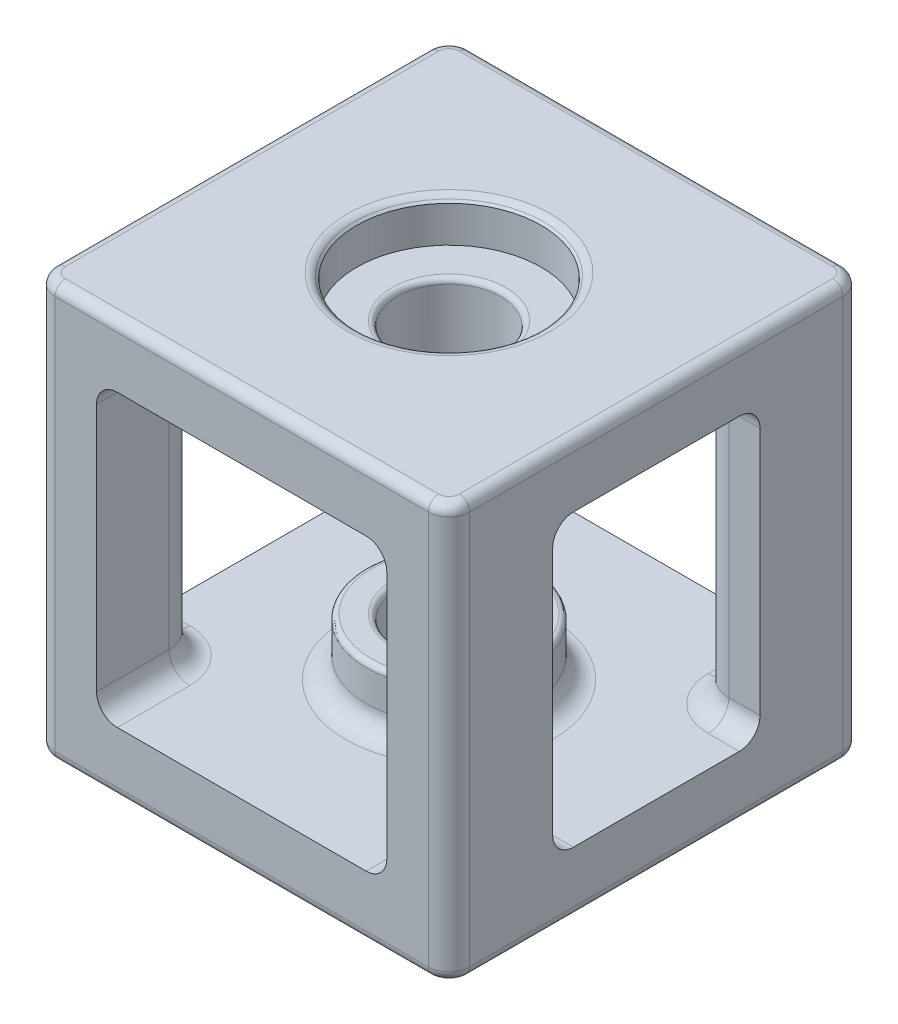
from build123d import *

# Parameters (mm, degrees)
SKETCH1_W             = 20
SKETCH1_H             = 20
BOSS_EXTRUDE1_DEPTH   = 3
SKETCH1_3_R           = 4
BOSS_EXTRUDE2_DEPTH   = 5.75
SKETCH2_R             = 2.5
CUT_EXTRUDE1_DEPTH    = 5.75
SKETCH1_4_W           = 3
SKETCH1_4_H           = 5
BOSS_EXTRUDE3_DEPTH   = 20
MIRROR2_START         = 17
MIRROR2_OUTLINE_R     = 2.5
MIRROR2_DEPTH         = 3
MIRROR2_START_2       = 14.25
MIRROR2_2_OUTLINE_R   = 4
MIRROR2_2_OUTLINE_R_2 = 2.5
MIRROR2_2_DEPTH       = 2.75
FILLET1_R             = 1
FILLET2_R             = 1.5
FILLET5_R             = 1
SKETCH5_R             = 4.45
CUT_EXTRUDE2_DEPTH    = 2
CHAMFER1_SIZE         = 0.25
FILLET6_R             = 0.5
FILLET7_R             = 0.25


# Read off the part's stored shape, not the designer's step: Mirror2
with BuildPart() as part:
    # Sketch1 → Boss-Extrude1 (new body)
    with BuildSketch(Plane(origin=(0, 0, 0), x_dir=(1, 0, 0), z_dir=(0, 1, 0))):
        Rectangle(SKETCH1_W, SKETCH1_H)
    extrude(amount=BOSS_EXTRUDE1_DEPTH)

    # Sketch1<3> → Boss-Extrude2 (add)
    with BuildSketch(Plane(origin=(0, 0, 0), x_dir=(1, 0, 0), z_dir=(0, 1, 0))):
        with Locations(Location((0, 0, 0), (0, 0, 90))):
            Circle(SKETCH1_3_R)
    extrude(amount=BOSS_EXTRUDE2_DEPTH)

    # Sketch2 → Cut-Extrude1 (cut)
    with BuildSketch(Plane(origin=(0, 5.75, 0), x_dir=(1, 0, 0), z_dir=(0, 1, 0))):
        with Locations(Location((0, 0, 0), (0, 0, 270))):
            Circle(SKETCH2_R)
    extrude(amount=-CUT_EXTRUDE1_DEPTH, mode=Mode.SUBTRACT)

    # Sketch1<4> → Boss-Extrude3 (add)
    with BuildSketch(Plane(origin=(0, 0, 0), x_dir=(1, 0, 0), z_dir=(0, 1, 0))):
        with Locations((8.5, 7.5)):
            Rectangle(SKETCH1_4_W, SKETCH1_4_H)
        with Locations((-8.5, 7.5)):
            Rectangle(SKETCH1_4_W, SKETCH1_4_H)
        with Locations((8.5, -7.5)):
            Rectangle(SKETCH1_4_W, SKETCH1_4_H)
        with Locations((-8.5, -7.5)):
            Rectangle(SKETCH1_4_W, SKETCH1_4_H)
    extrude(amount=BOSS_EXTRUDE3_DEPTH)

    # Mirror2 outline → Mirror2 (add)
    with BuildSketch(Plane(origin=(0, 0, 0), x_dir=(1, 0, 0), z_dir=(0, 1, 0)).offset(MIRROR2_START)):
        Polygon((7, 5), (7, 10), (-7, 10), (-7, 5), (-10, 5), (-10, -5), (-7, -5), (-7, -10), (7, -10), (7, -5), (10, -5), (10, 5), align=None)
        Circle(MIRROR2_OUTLINE_R, mode=Mode.SUBTRACT)
    extrude(amount=MIRROR2_DEPTH)

    # Mirror2 2 outline → Mirror2 2 (add)
    with BuildSketch(Plane(origin=(0, 0, 0), x_dir=(1, 0, 0), z_dir=(0, 1, 0)).offset(MIRROR2_START_2)):
        Circle(MIRROR2_2_OUTLINE_R)
        Circle(MIRROR2_2_OUTLINE_R_2, mode=Mode.SUBTRACT)
    extrude(amount=MIRROR2_2_DEPTH)

    # Fillet1
    fillet1_edges = [part.edges().sort_by_distance(p)[0] for p in [
        (-10, 10, -10),
        (-10, 10, 10),
        (10, 10, 10),
        (10, 10, -10),
    ]]
    fillet(fillet1_edges, radius=FILLET1_R)

    # Fillet2
    fillet2_edges = [part.edges().sort_by_distance(p)[0] for p in [
        (-7, 10, 5),
        (7, 10, 5),
        (7, 10, -5),
        (-7, 10, -5),
    ]]
    fillet(fillet2_edges, radius=FILLET2_R)

    # Fillet5
    fillet5_edges = [part.edges().sort_by_distance(p)[0] for p in [
        (9.25, 17, -5),
        (9.25, 17, 5),
        (-7, 17, 8.25),
        (7, 17, 8.25),
        (0, 3, 4),
        (-4, 17, 0),
        (-9.25, 17, 5),
        (-9.25, 3, 5),
        (7, 17, -8.25),
        (7, 3, -8.25),
        (-7, 17, -8.25),
        (-7, 3, -8.25),
        (-9.25, 17, -5),
        (-9.25, 3, -5),
        (-7.439339828, 3, 5.439339828),
        (-7.439339828, 17, 5.439339828),
        (7.439339828, 3, 5.439339828),
        (7.439339828, 17, 5.439339828),
        (7.439339828, 3, -5.439339828),
        (7.439339828, 17, -5.439339828),
        (-7.439339828, 3, -5.439339828),
        (-7.439339828, 17, -5.439339828),
        (9.25, 3, -5),
        (9.25, 3, 5),
        (7, 3, 8.25),
        (-7, 3, 8.25),
    ]]
    fillet(fillet5_edges, radius=FILLET5_R)

    # Sketch5 → Cut-Extrude2 (cut)
    with BuildSketch(Plane(origin=(0, 20, 0), x_dir=(1, 0, 0), z_dir=(0, 1, 0))):
        with Locations(Location((0, 0, 0), (0, 0, 270))):
            Circle(SKETCH5_R)
    extrude(amount=-CUT_EXTRUDE2_DEPTH, mode=Mode.SUBTRACT)

    # Chamfer1
    chamfer1_edges = [part.edges().sort_by_distance(p)[0] for p in [
        (0, 20, -4.45),
    ]]
    chamfer(chamfer1_edges, length=CHAMFER1_SIZE)

    # Fillet6
    fillet6_edges = [part.edges().sort_by_distance(p)[0] for p in [
        (-10, 20, 0),
        (-10, 0, 0),
        (10, 0, 0),
        (0, 0, 10),
        (0, 0, -10),
        (-9.707106781, 0, 9.707106781),
        (9.707106781, 0, 9.707106781),
        (9.707106781, 0, -9.707106781),
        (-9.707106781, 0, -9.707106781),
        (0, 20, -10),
        (0, 20, 10),
        (10, 20, 0),
        (-9.707106781, 20, 9.707106781),
        (9.707106781, 20, 9.707106781),
        (9.707106781, 20, -9.707106781),
        (-9.707106781, 20, -9.707106781),
        (0, 0, -2.5),
        (0, 20, -4.7),
    ]]
    fillet(fillet6_edges, radius=FILLET6_R)

    # Fillet7
    fillet7_edges = [part.edges().sort_by_distance(p)[0] for p in [
        (-4, 14.25, 0),
        (0, 5.75, 4),
        (-2.5, 14.25, 0),
        (0, 5.75, -2.5),
        (-2.5, 18, 0),
    ]]
    fillet(fillet7_edges, radius=FILLET7_R)


solid = part.part
